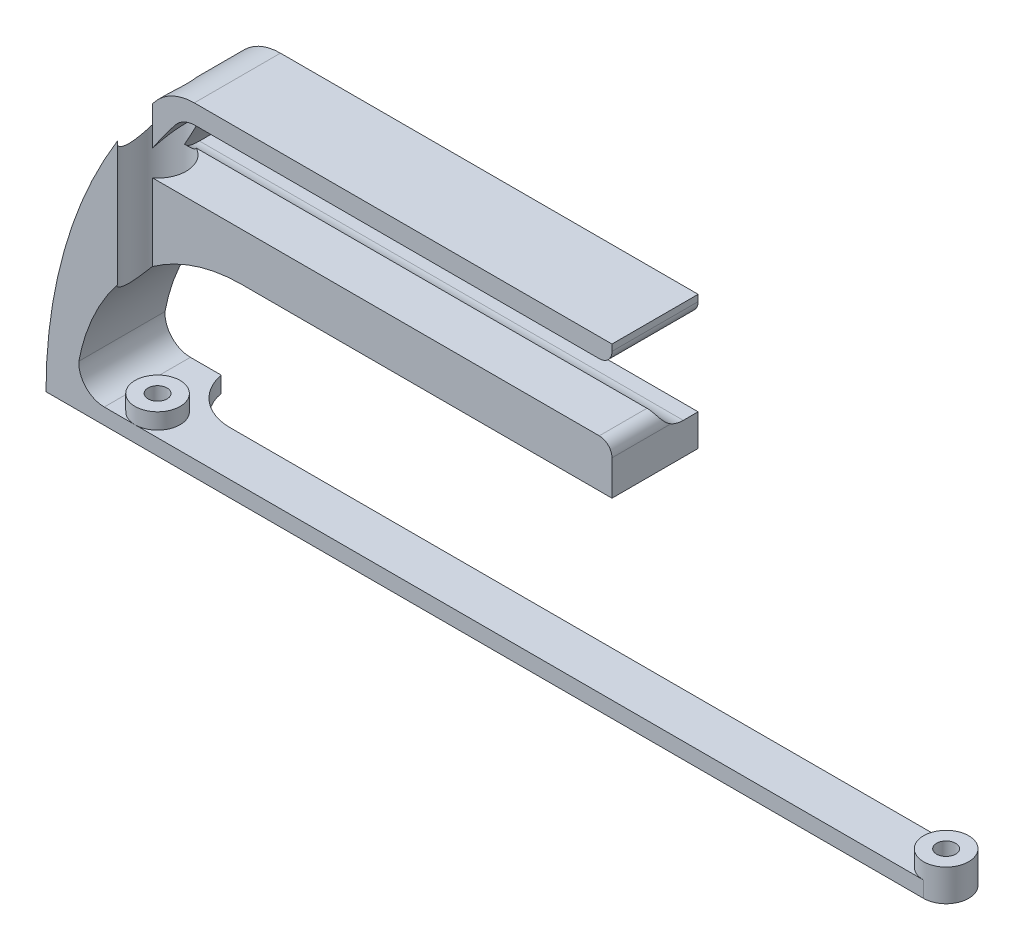
from build123d import *

# Parameters (mm, degrees)
SKETCH1_R                       = 4.5
BOSS_EXTRUDE1_DEPTH             = 6.35
BOSS_EXTRUDE1_2_DEPTH           = 6.35
BOSS_EXTRUDE2_DEPTH             = 3.175
BOSS_EXTRUDE3_DEPTH             = 12.7
BOSS_EXTRUDE3_DIRECTION_2_REACH = 85.603
FILLET1_R                       = 5.08
FILLET2_R                       = 10.16
F_6_CLEARANCE_HOLE1_D           = 3.7973
F_6_CLEARANCE_HOLE1_DEPTH       = 6.35
FILLET5_START                   = -12.7
FILLET5_DEPTH                   = 17.2
CUT_EXTRUDE1_START              = -56.211523666
CUT_EXTRUDE1_DEPTH              = 56.211523666
BOSS_EXTRUDE5_REACH             = 132.89
BOSS_EXTRUDE5_END_RADIUS        = 5.715
SKETCH8_W                       = 9.525
SKETCH8_H                       = 3.175
FILLET6_R                       = 5.08
FILLET7_R                       = 2.54


with BuildPart() as part:
    # Sketch1 → Boss-Extrude1 (new body)
    with BuildSketch(Plane(origin=(0, 0, 0), x_dir=(1, 0, 0), z_dir=(0, 1, 0))):
        with Locations(Location((78.74, 0, 0), (0, 0, 270))):
            Circle(SKETCH1_R)
    extrude(amount=BOSS_EXTRUDE1_DEPTH)



with BuildPart() as body_2:
    # Sketch1 → Boss-Extrude1 2 (new body)
    with BuildSketch(Plane(origin=(0, 0, 0), x_dir=(1, 0, 0), z_dir=(0, 1, 0))):
        with Locations(Location((-78.74, 0, 0), (0, 0, 90))):
            Circle(SKETCH1_R)
    extrude(amount=BOSS_EXTRUDE1_2_DEPTH)


with BuildPart() as part_1:
    add(part.part)

    add(body_2.part)  # Boss-Extrude2 merges body 2
    # Sketch2 → Boss-Extrude2 (add)
    with BuildSketch(Plane(origin=(0, 0, 0), x_dir=(1, 0, 0), z_dir=(0, 1, 0))):
        with BuildLine():
            Line((78.74, 4.5), (-78.74, 4.5))
            ThreePointArc((-78.74, 4.5), (-75.558019485, 3.181980515), (-74.24, 0))
            ThreePointArc((-74.24, 0), (-75.558019485, -3.181980515), (-78.74, -4.5))
            Line((-78.74, -4.5), (78.74, -4.5))
            ThreePointArc((78.74, -4.5), (74.24, 0), (78.74, 4.5))
        make_face()
    extrude(amount=BOSS_EXTRUDE2_DEPTH)

    # Sketch3 → Boss-Extrude3 (add)
    with BuildSketch(Plane.XY):
        with BuildLine():
            Line((-78.74, 0), (-78.74, 3.175))
            Line((-78.74, 3.175), (-90.114089339, 3.175))
            ThreePointArc((-90.114089339, 3.175), (-88.335814095, 20.989027697), (-83.071170469, 38.1))
            Line((-83.071170469, 38.1), (16.51, 38.1))
            Line((16.51, 38.1), (16.51, 44.45))
            Line((16.51, 44.45), (-80.105931514, 44.45))
            ThreePointArc((-80.105931514, 44.45), (-75.082403553, 53.007088382), (-69.148535375, 60.96))
            Line((-69.148535375, 60.96), (16.51, 60.96))
            Line((16.51, 60.96), (16.51, 64.77))
            Line((16.51, 64.77), (-71.560865702, 64.77))
            ThreePointArc((-71.560865702, 64.77), (-90.064324673, 34.70630809), (-96.52, 0))
            Line((-96.52, 0), (-78.74, 0))
        make_face()
    extrude(amount=-BOSS_EXTRUDE3_DEPTH)

    # Boss-Extrude3 direction 2: up to this face of the body (flat: up to its plane)
    boss_extrude3_direction_2_end = Plane(part_1.part.faces().sort_by_distance((0, 1.5875, 4.5))[0])
    # Sketch3 → Boss-Extrude3 direction 2 (add, up to the picked face)
    with BuildSketch(Plane.XY, mode=Mode.PRIVATE) as boss_extrude3_direction_2_sk1:
        with BuildLine():
            Line((-78.74, 0), (-78.74, 3.175))
            Line((-78.74, 3.175), (-90.114089339, 3.175))
            ThreePointArc((-90.114089339, 3.175), (-88.335814095, 20.989027697), (-83.071170469, 38.1))
            Line((-83.071170469, 38.1), (16.51, 38.1))
            Line((16.51, 38.1), (16.51, 44.45))
            Line((16.51, 44.45), (-80.105931514, 44.45))
            ThreePointArc((-80.105931514, 44.45), (-75.082403553, 53.007088382), (-69.148535375, 60.96))
            Line((-69.148535375, 60.96), (16.51, 60.96))
            Line((16.51, 60.96), (16.51, 64.77))
            Line((16.51, 64.77), (-71.560865702, 64.77))
            ThreePointArc((-71.560865702, 64.77), (-90.064324673, 34.70630809), (-96.52, 0))
            Line((-96.52, 0), (-78.74, 0))
        make_face()
    boss_extrude3_direction_2_tool1 = split(extrude(boss_extrude3_direction_2_sk1.sketch, amount=BOSS_EXTRUDE3_DIRECTION_2_REACH, mode=Mode.PRIVATE), bisect_by=boss_extrude3_direction_2_end, keep=Keep.BOTH, mode=Mode.PRIVATE)
    add(boss_extrude3_direction_2_tool1.solids().sort_by(Axis((-47.115631, 42.638129, 0), (0, 0, 1)))[0])

    # Fillet1
    fillet1_edges = [part_1.edges().sort_by_distance(p)[0] for p in [
        (-69.148535375, 60.96, -4.1),
        (-90.114089339, 3.175, -4.1),
    ]]
    fillet(fillet1_edges, radius=FILLET1_R)

    # Fillet2
    # the kernel refuses this fillet: 10.16 mm, written as the material it adds along each edge
    with BuildSketch(Plane(origin=(-78.74, 0, -4.5), x_dir=(1, 0, 0), z_dir=(0, 1, 0))) as fillet2_piece_1:
        with BuildLine():
            CenterArc((9.969152421, 10.16), FILLET2_R, 191.12285511, 78.87714489)
            Line((0, 8.2), (0, 0))
            Line((0, 0), (9.969152421, 0))
        make_face()
    extrude(amount=3.175)
    # the kernel refuses this fillet: 10.16 mm, written as the material it takes off along each edge
    with BuildSketch(Plane(origin=(-71.560865702, 64.77, 16.814827808), x_dir=(1, 0, 0), z_dir=(0, 0, -1))) as fillet2_2_piece_1:
        with BuildLine():
            CenterArc((4.659464371, 10.16), FILLET2_R, 219.223932399, 50.776067601)
            ThreePointArc((-3.211288726, 3.735294118), (-1.629477245, 1.847157571), (0, 0))
            Line((0, 0), (4.659464371, 0))
        make_face()
    extrude(amount=41.829655616, mode=Mode.SUBTRACT)

    # #6 Clearance Hole1
    with Locations(Plane(origin=(-78.74, 6.35, 0), x_dir=(0, 0, 1), z_dir=(0, 1, 0))):
        with Locations((0, 0), (0, 157.48)):
            Hole(F_6_CLEARANCE_HOLE1_D / 2, depth=F_6_CLEARANCE_HOLE1_DEPTH)

    # Fillet5: read off the stored shape, not the designer's step
    # Fillet5 outline → Fillet5 (add)
    with BuildSketch(Plane.XY.offset(FILLET5_START)):
        with BuildLine():
            add(Edge.make_bspline(
                [(-57.486261954, 38.1), (-84.476947832, 38.1), (-89.953142639, 8.558476434)],
                knots=[0, 0, 0, 1, 1, 1], degree=2, weights=[1, 0.768852264, 1]))
            Line((-57.486261954, 38.1), (-83.071170469, 38.1))
            ThreePointArc((-83.071170469, 38.1), (-87.76402471, 23.620872526), (-89.953142639, 8.558476434))
        make_face()
    extrude(amount=FILLET5_DEPTH)

    # Cut-Extrude1: read off the stored shape, not the designer's step
    # Cut-Extrude1 outline → Cut-Extrude1 (cut)
    with BuildSketch(Plane(origin=(0, 64.77, 0), x_dir=(1, 0, 0), z_dir=(0, 1, 0)).offset(CUT_EXTRUDE1_START)):
        with BuildLine():
            Line((-82.262956855, -4.5), (-75.217043145, -4.5))
            ThreePointArc((-75.217043145, -4.5), (-78.74, 5.715), (-82.262956855, -4.5))
        make_face()
    extrude(amount=CUT_EXTRUDE1_DEPTH, mode=Mode.SUBTRACT)

    # Boss-Extrude5: up to this cylinder (the profile starts outside it)
    boss_extrude5_end = Plane(origin=(-78.74, 46.0375, 0), z_dir=(0, 1, 0)) * Cylinder(BOSS_EXTRUDE5_END_RADIUS, 278.21, mode=Mode.PRIVATE)
    # Sketch8 → Boss-Extrude5 (add, up to the surface)
    with BuildSketch(Plane(origin=(16.51, 0, 0), x_dir=(0, 0, -1), z_dir=(1, 0, 0)), mode=Mode.PRIVATE) as boss_extrude5_sk1:
        with Locations((0.2625, 46.0375)):
            Rectangle(SKETCH8_W, SKETCH8_H)
    boss_extrude5_tool1 = extrude(boss_extrude5_sk1.sketch, amount=-BOSS_EXTRUDE5_REACH, mode=Mode.PRIVATE) - boss_extrude5_end
    add(boss_extrude5_tool1.solids().sort_by_distance((16.51, 46.0375, -0.2625))[0])

    # Fillet6
    # the kernel refuses this fillet: 5.08 mm, written as the material it adds along each edge
    with BuildSketch(Plane(origin=(16.51, 44.45, -5.025), x_dir=(0, 1, 0), z_dir=(-1, 0, 0))) as fillet6_piece_1_section:
        with BuildLine():
            CenterArc((5.08, 4.709286039), FILLET6_R, 180, 67.975687163)
            Line((0, 4.709286039), (0, 0))
            Line((0, 0), (3.175, 0))
        make_face()
    fillet6_piece_1 = extrude(amount=104.300973375, mode=Mode.PRIVATE)
    fillet6_piece_1 = fillet6_piece_1 - Plane(origin=(-78.74, 44.45, 0), x_dir=(1, 0, 0), z_dir=(0, 1, 0)) * Cylinder(5.715, 228, mode=Mode.PRIVATE)
    fillet6_piece_1 = fillet6_piece_1 & Plane(origin=(0, 0, -5.025), x_dir=(-0.7414097151042524, 0.671052631578948, 0), z_dir=(0, 0, 1)) * Cylinder(96.52, 228, mode=Mode.PRIVATE)
    add(fillet6_piece_1)

    # Fillet7
    fillet7_edges = [part_1.edges().sort_by_distance(p)[0] for p in [
        (16.51, 47.625, -0.2625),
        (16.51, 60.96, -4.1),
    ]]
    fillet(fillet7_edges, radius=FILLET7_R)


solid = part_1.part
